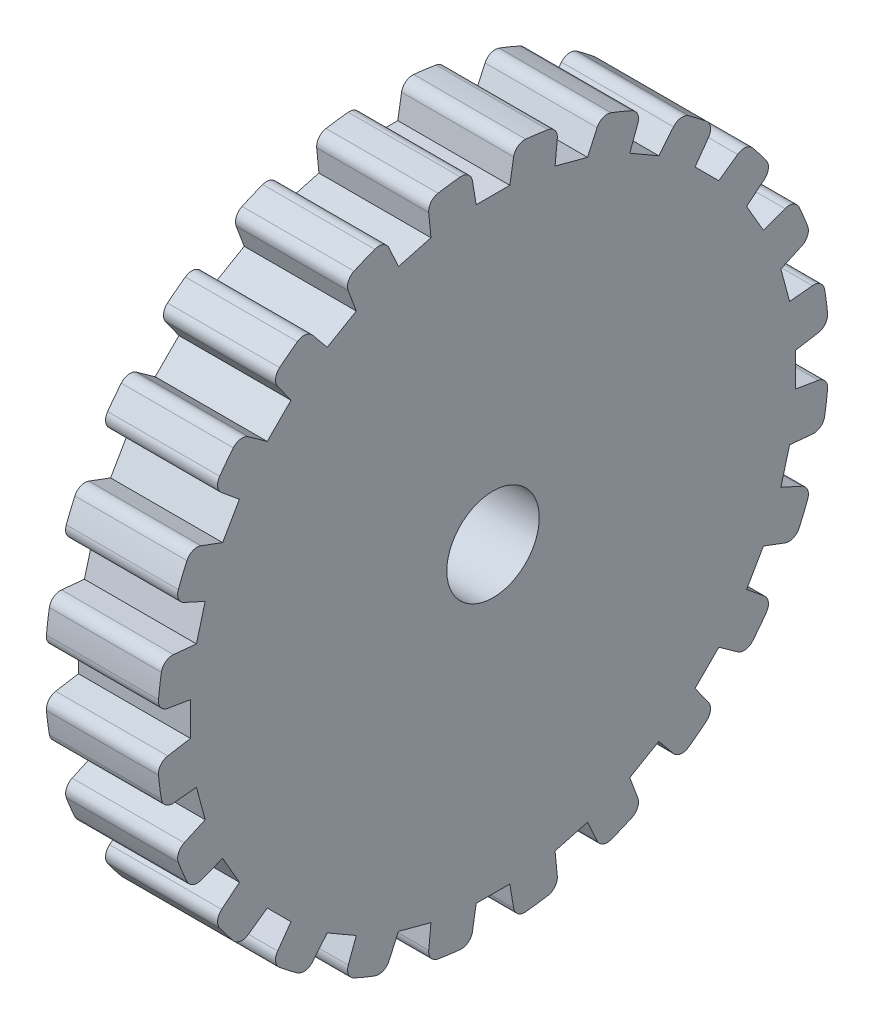
from build123d import *

# Parameters (mm, degrees)
CUT_EXTRUDE1_DEPTH       = 44
FILLET1_R                = 1
CIRPATTERN1_COUNT        = 24
FILLET1_OF_CIRPATTERN1_R = 1
SKETCH4_R                = 4.125
CUT_EXTRUDE2_DEPTH       = 10


with BuildPart() as part:
    # Sketch1 → Revolve1 (revolve)
    with BuildSketch(Plane.XY):
        Polygon((0, 0), (-10, 0), (-10, 5), (-10, 20), (-10, 30), (0, 30), (0, 20), (0, 5), align=None)
    revolve(axis=Axis((0, 0, 0), (-1, 0, 0)))

    # Sketch2 → Cut-Extrude1 (cut)
    with BuildSketch(Plane(origin=(0, 0, 0), x_dir=(0, 0, -1), z_dir=(1, 0, 0))):
        Polygon((-2.5, 33), (2.5, 33), (1.5, 27), (-1.5, 27), align=None)
    cut_extrude1 = extrude(amount=-CUT_EXTRUDE1_DEPTH, mode=Mode.SUBTRACT)

    # Fillet1
    fillet1_edges = [part.edges().sort_by_distance(p)[0] for p in [
        (-5, 29.93399212, -1.988998687),
        (-5, 29.93399212, 1.988998687),
    ]]
    fillet(fillet1_edges, radius=FILLET1_R)

    # CirPattern1: Cut-Extrude1 ×24 about axis
    cirpattern1_axis = Axis((0, 0, 0), (1, 0, 0))
    for i in range(1, CIRPATTERN1_COUNT):
        add(cut_extrude1.rotate(cirpattern1_axis, i * 360 / CIRPATTERN1_COUNT), mode=Mode.SUBTRACT)

    # Fillet1 of CirPattern1
    fillet1_of_cirpattern1_edges = [part.edges().sort_by_distance(p)[0] for p in [
        (-5, 29.428806813, 5.826262057),
        (-5, 28.399225332, 9.668712456),
        (-5, 26.918096956, 13.244472669),
        (-5, 24.929098269, 16.689519451),
        (-5, 22.572963275, 19.760094357),
        (-5, 19.760094357, 22.572963275),
        (-5, 16.689519451, 24.929098269),
        (-5, 13.244472669, 26.918096956),
        (-5, 9.668712456, 28.399225332),
        (-5, 5.826262057, 29.428806813),
        (-5, 1.988998687, 29.93399212),
        (-5, -1.988998687, 29.93399212),
        (-5, -5.826262057, 29.428806813),
        (-5, -9.668712456, 28.399225332),
        (-5, -13.244472669, 26.918096956),
        (-5, -16.689519451, 24.929098269),
        (-5, -19.760094357, 22.572963275),
        (-5, -22.572963275, 19.760094357),
        (-5, -24.929098269, 16.689519451),
        (-5, -26.918096956, 13.244472669),
        (-5, -28.399225332, 9.668712456),
        (-5, -29.428806813, 5.826262057),
        (-5, -29.93399212, 1.988998687),
        (-5, -29.93399212, -1.988998687),
        (-5, -29.428806813, -5.826262057),
        (-5, -28.399225332, -9.668712456),
        (-5, -26.918096956, -13.244472669),
        (-5, -24.929098269, -16.689519451),
        (-5, -22.572963275, -19.760094357),
        (-5, -19.760094357, -22.572963275),
        (-5, -16.689519451, -24.929098269),
        (-5, -13.244472669, -26.918096956),
        (-5, -9.668712456, -28.399225332),
        (-5, -5.826262057, -29.428806813),
        (-5, -1.988998687, -29.93399212),
        (-5, 1.988998687, -29.93399212),
        (-5, 5.826262057, -29.428806813),
        (-5, 9.668712456, -28.399225332),
        (-5, 13.244472669, -26.918096956),
        (-5, 16.689519451, -24.929098269),
        (-5, 19.760094357, -22.572963275),
        (-5, 22.572963275, -19.760094357),
        (-5, 24.929098269, -16.689519451),
        (-5, 26.918096956, -13.244472669),
        (-5, 28.399225332, -9.668712456),
        (-5, 29.428806813, -5.826262057),
    ]]
    fillet(fillet1_of_cirpattern1_edges, radius=FILLET1_OF_CIRPATTERN1_R)

    # Sketch4 → Cut-Extrude2 (cut)
    with BuildSketch(Plane.ZY.offset(10)):
        Circle(SKETCH4_R)
    extrude(amount=-CUT_EXTRUDE2_DEPTH, mode=Mode.SUBTRACT)


solid = part.part
